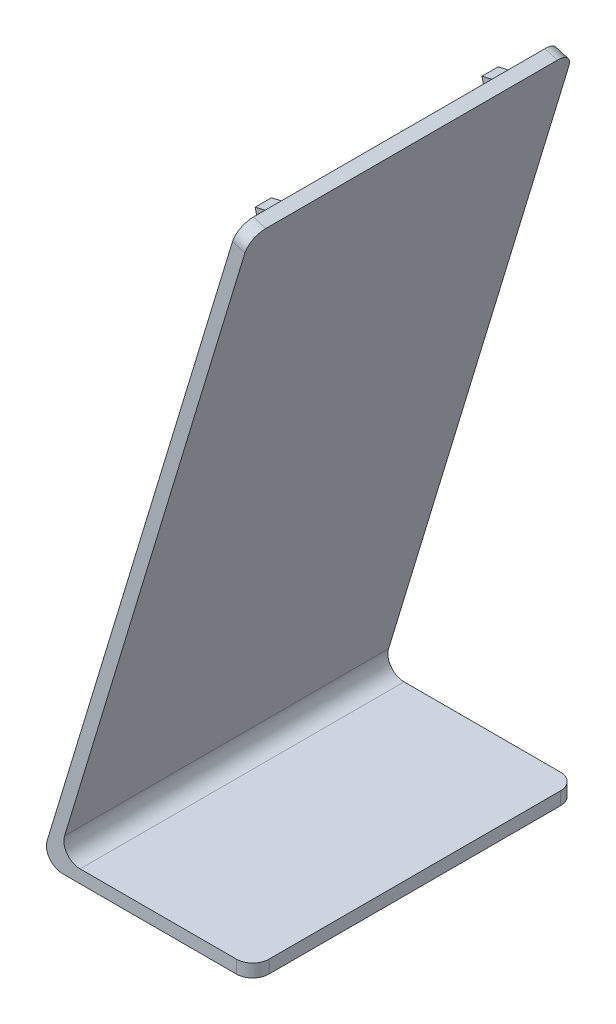
from build123d import *

# Parameters (mm, degrees)
EXTRU_MINCE1_DEPTH         = 100
EXTRU_MINCE2_DEPTH         = 5
EXTRU_MINCE3_DEPTH         = 5
CONG_1_R                   = 10
R_P_TITION_START           = 80
R_P_TITION_LIN_AIRE1_DEPTH = 5
CONG_2_R                   = 5


# Read off the part's stored shape, not the designer's step: Répétition linéaire1
with BuildPart() as part:
    # Esquisse1 → Extru.-Mince1 (new body)
    with BuildSketch(Plane.XY):
        Polygon((0, 0), (-65.404068622, 0), (-4.782306964, 200), (-0.954292763, 198.839695178), (-60.011920576, 4), (0, 4), align=None)
    extrude(amount=EXTRU_MINCE1_DEPTH)

    # Esquisse2 → Extru.-Mince2 (add)
    with BuildSketch(Plane.XY.offset(10)):
        Polygon((-11.060818094, 179.286279518), (-14.23934022, 192.904801434), (-10.344030265, 193.813955082), (-7.16550814, 180.195433166), align=None)
        Polygon((-40.068438655, 83.585924506), (-43.246960781, 97.204446422), (-39.351650826, 98.11360007), (-36.1731287, 84.495078154), align=None)
    extrude(amount=EXTRU_MINCE2_DEPTH)

    # Esquisse3 → Extru.-Mince3 (add)
    with BuildSketch(Plane.XY.offset(45)):
        Polygon((-18.341466727, 155.266361808), (-26.702263311, 169.885700914), (-23.229995746, 171.871489915), (-14.869199162, 157.252150809), align=None)
        Polygon((-32.333054107, 109.106082076), (-40.693850691, 123.725421182), (-37.221583126, 125.711210183), (-28.860786542, 111.091871077), align=None)
        Polygon((-51.073031786, 47.280172809), (-59.433828371, 61.899511915), (-55.961560806, 63.885300916), (-47.600764221, 49.26596181), align=None)
    extrude(amount=EXTRU_MINCE3_DEPTH)

    # Congé1
    cong_1_edges = [part.edges().sort_by_distance(p)[0] for p in [
        (-11.060818094, 179.286279518, 12.5),
        (-40.068438655, 83.585924506, 12.5),
        (-18.341466727, 155.266361808, 47.5),
        (-32.333054107, 109.106082076, 47.5),
        (-51.073031786, 47.280172809, 47.5),
    ]]
    fillet(cong_1_edges, radius=CONG_1_R)

    # Répétition linéaire1 outline → Répétition linéaire1 (add)
    with BuildSketch(Plane.XY.offset(R_P_TITION_START)):
        with BuildLine():
            Line((-40.845695505, 81.021641222), (-37.74782901, 91.241952907))
            Line((-37.74782901, 91.241952907), (-39.351650826, 98.11360007))
            Line((-39.351650826, 98.11360007), (-43.246960781, 97.204446422))
            Line((-43.246960781, 97.204446422), (-40.677456119, 86.195287398))
            ThreePointArc((-40.677456119, 86.195287398), (-40.421014092, 83.597389742), (-40.845695505, 81.021641222))
        make_face()
        with BuildLine():
            Line((-8.74020845, 186.942307919), (-10.344030265, 193.813955082))
            Line((-10.344030265, 193.813955082), (-14.23934022, 192.904801434))
            Line((-14.23934022, 192.904801434), (-11.669835559, 181.89564241))
            ThreePointArc((-11.669835559, 181.89564241), (-11.413393531, 179.297744754), (-11.838074945, 176.721996234))
            Line((-11.838074945, 176.721996234), (-8.74020845, 186.942307919))
        make_face()
    extrude(amount=R_P_TITION_LIN_AIRE1_DEPTH)

    # Congé2
    cong_2_edges = [part.edges().sort_by_distance(p)[0] for p in [
        (0, 2, 100),
        (0, 2, 0),
        (-2.868299864, 199.419847589, 0),
        (-2.868299864, 199.419847589, 100),
        (-60.011920576, 4, 50),
        (-65.404068622, 0, 50),
    ]]
    fillet(cong_2_edges, radius=CONG_2_R)


solid = part.part
